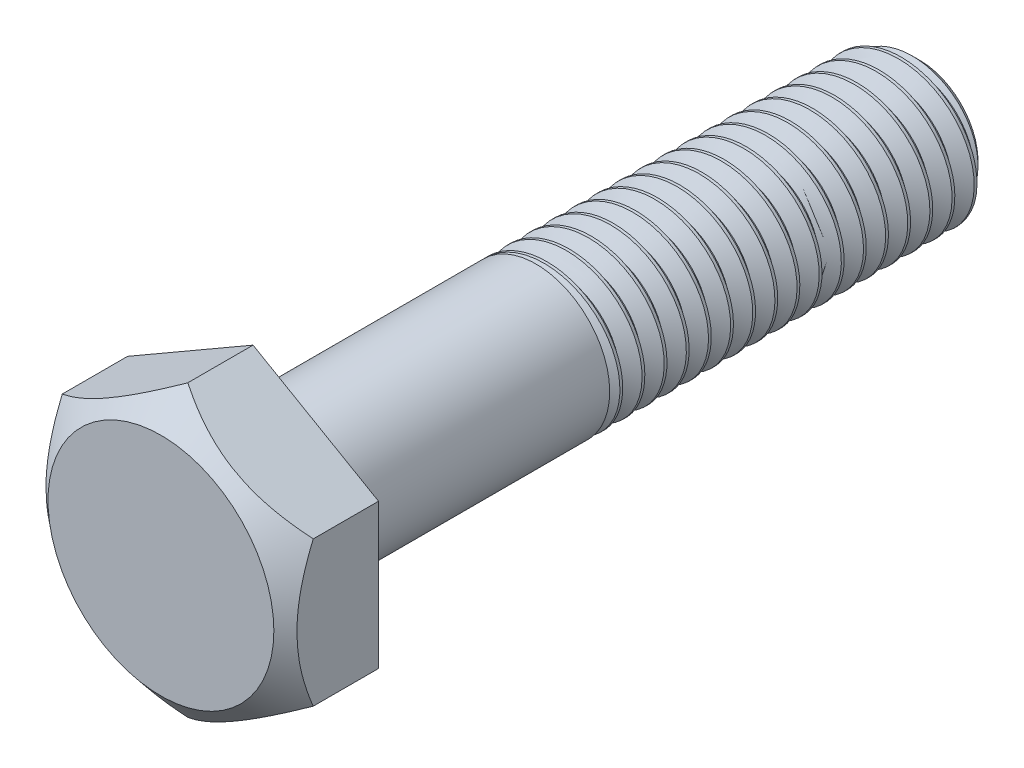
from build123d import *
from build123d.topology import SkipClean

# Parameters (mm, degrees)
BOSS_EXTRUDE1_DEPTH = 6.4
SKETCH4_OUTSIDE_W   = 159.262
SKETCH4_OUTSIDE_H   = 161.892
SKETCH4_OUTSIDE_R   = 7.65
CUT_EXTRUDE1_DEPTH  = 54.014557749
CUT_EXTRUDE1_DRAFT  = -50
SKETCH9_R           = 9.814954576
SKETCH9_R_2         = 8.075
CUT_EXTRUDE2_DEPTH  = 0.16
CUT_SWEEP1_PITCH    = 1.5
SKETCH8_W           = 1.5
SKETCH8_H           = 5


# Read off the part's stored shape, not the designer's step: Split1
with BuildPart() as part:
    # Sketch2 → Revolve1 (revolve)
    with BuildSketch(Plane(origin=(0, 0, 0), x_dir=(0, 0, -1), z_dir=(1, 0, 0)), mode=Mode.PRIVATE) as revolve1_sk:
        Polygon((45, 0), (0, 0), (0, 5), (43.95, 5), (45, 3.95), align=None)
    revolve(revolve1_sk.sketch.rotate(Axis((0, 0, -45), (0, 0, 1)), 90), axis=Axis((0, 0, -45), (0, 0, 1)))

    # Sketch3 → Boss-Extrude1 (add)
    with BuildSketch(Plane.XY):
        Polygon((0, 9.814954576), (-8.5, 4.907477288), (-8.5, -4.907477288), (0, -9.814954576), (8.5, -4.907477288), (8.5, 4.907477288), align=None)
    extrude(amount=BOSS_EXTRUDE1_DEPTH)


with BuildPart() as cut_extrude1_tool:
    # Sketch4 outside → Cut-Extrude1 (with draft: the straight prism first)
    with BuildSketch(Plane.XY.offset(6.4)):
        Rectangle(SKETCH4_OUTSIDE_W, SKETCH4_OUTSIDE_H)
        Circle(SKETCH4_OUTSIDE_R, mode=Mode.SUBTRACT)
    extrude(amount=-CUT_EXTRUDE1_DEPTH)
    # Cut-Extrude1: the draft: its side faces are tilted about the plane it starts from
    cut_extrude1_sides = [cut_extrude1_tool.faces().sort_by_distance(p)[0] for p in [
        (0, -80.946, -20.607278875),
        (79.631, 0, -20.607278875),
        (0, 80.946, -20.607278875),
        (-79.631, 0, -20.607278875),
        (-7.65, 0, -20.607278875),
    ]]
    draft(cut_extrude1_sides, Plane.XY.offset(6.4), CUT_EXTRUDE1_DRAFT)


with BuildPart() as part_1:
    add(part.part)

    # Cut-Extrude1: cut by cut_extrude1_tool
    add(cut_extrude1_tool.part, mode=Mode.SUBTRACT)

    # Sketch9 → Cut-Extrude2 (cut)
    with BuildSketch(Plane(origin=(0, 0, 0), x_dir=(-1, 0, 0), z_dir=(0, 0, -1))):
        Circle(SKETCH9_R)
        Circle(SKETCH9_R_2, mode=Mode.SUBTRACT)
    extrude(amount=-CUT_EXTRUDE2_DEPTH, mode=Mode.SUBTRACT)


with BuildPart() as body_2:
    # Split1: the piece on the far side of the plane
    add(part_1.part)
    split(bisect_by=Plane.XY, keep=Keep.BOTTOM)

    # Cut-Sweep1: the profile of Sketch6 screwed along a right-hand helix of 18.333333 turns, 8 arcs to a turn; built about Z, then put on its axis
    cut_sweep1_z = Axis((0, 0, 0), (0, 0, 1))
    cut_sweep1_corners = [(5.081189882, 0, 0.046875), (5.081189882, 0, -1.359375), (4.025721421, 0, -0.75), (4.025721421, 0, -0.5625)]
    with BuildLine(mode=Mode.PRIVATE) as cut_sweep1_profile:
        Line(cut_sweep1_corners[0], cut_sweep1_corners[1])
        Line(cut_sweep1_corners[1], cut_sweep1_corners[2])
        Line(cut_sweep1_corners[2], cut_sweep1_corners[3])
        Line(cut_sweep1_corners[3], cut_sweep1_corners[0])
    cut_sweep1_cap = Face(cut_sweep1_profile.wire())
    cut_sweep1_turn_angles = [0, 22.5, 45, 67.5, 90, 112.5, 135, 157.5, 180, 202.5, 225, 247.5, 270, 292.5, 315, 337.5, 360]
    cut_sweep1_turn_weights = [1, 0.9238795325112867, 1, 0.9238795325112867, 1, 0.9238795325112867, 1, 0.9238795325112867, 1, 0.9238795325112867, 1, 0.9238795325112867, 1, 0.9238795325112867, 1, 0.9238795325112867, 1]
    cut_sweep1_turn_rails = [Edge.make_bspline([Vector(p[0], p[1], 0).rotate(cut_sweep1_z, cut_sweep1_turn_angles[k]) / cut_sweep1_turn_weights[k] + Vector(0, 0, p[2] + CUT_SWEEP1_PITCH * cut_sweep1_turn_angles[k] / 360) for k in range(17)], [0, 0, 0, 1, 1, 2, 2, 3, 3, 4, 4, 5, 5, 6, 6, 7, 7, 8, 8, 8], 2, cut_sweep1_turn_weights) for p in cut_sweep1_corners]
    cut_sweep1_turn_sides = [Face.make_surface_from_curves(cut_sweep1_turn_rails[p[0]], cut_sweep1_turn_rails[p[1]]) for p in [(0, 1), (1, 2), (2, 3), (3, 0)]]
    cut_sweep1_last_angles = [6480, 6502.5, 6525, 6547.5, 6570, 6585, 6600]
    cut_sweep1_last_weights = [1, 0.9238795325112867, 1, 0.9238795325112867, 1, 0.9659258262889758, 1]
    cut_sweep1_last_rails = [Edge.make_bspline([Vector(p[0], p[1], 0).rotate(cut_sweep1_z, cut_sweep1_last_angles[k]) / cut_sweep1_last_weights[k] + Vector(0, 0, p[2] + CUT_SWEEP1_PITCH * cut_sweep1_last_angles[k] / 360) for k in range(7)], [0, 0, 0, 1, 1, 2, 2, 3, 3, 3], 2, cut_sweep1_last_weights) for p in cut_sweep1_corners]
    cut_sweep1_last_sides = [Face.make_surface_from_curves(cut_sweep1_last_rails[p[0]], cut_sweep1_last_rails[p[1]]) for p in [(0, 1), (1, 2), (2, 3), (3, 0)]]
    cut_sweep1 = Plane(origin=(0, 0, -45), x_dir=(0, 1, 0), z_dir=(0, 0, 1)) * Solid(Shell([*[p.moved(Location((0, 0, CUT_SWEEP1_PITCH * i))) for i in range(18) for p in cut_sweep1_turn_sides], *cut_sweep1_last_sides, cut_sweep1_cap, cut_sweep1_cap.rotate(cut_sweep1_z, 6600).moved(Location((0, 0, CUT_SWEEP1_PITCH * 6600 / 360)))]))
    add(cut_sweep1, mode=Mode.SUBTRACT)


with BuildPart() as part_2:
    add(part_1.part)

    # Split1
    split(bisect_by=Plane.XY, keep=Keep.TOP)

    # Combine1: union body 2
    add(body_2.part)

    # Sketch8 → Revolve2 (revolve)
    with SkipClean():  # the faces are left unmerged after this step: merging them gives an invalid solid
        with BuildSketch(Plane(origin=(0, 0, 0), x_dir=(0, 0, -1), z_dir=(1, 0, 0)), mode=Mode.PRIVATE) as revolve2_sk:
            with Locations((18.25, 2.5)):
                Rectangle(SKETCH8_W, SKETCH8_H)
        revolve(revolve2_sk.sketch.rotate(Axis((0, 0, -17.5), (0, 0, -1)), 270), axis=Axis((0, 0, -17.5), (0, 0, -1)))


solid = part_2.part
